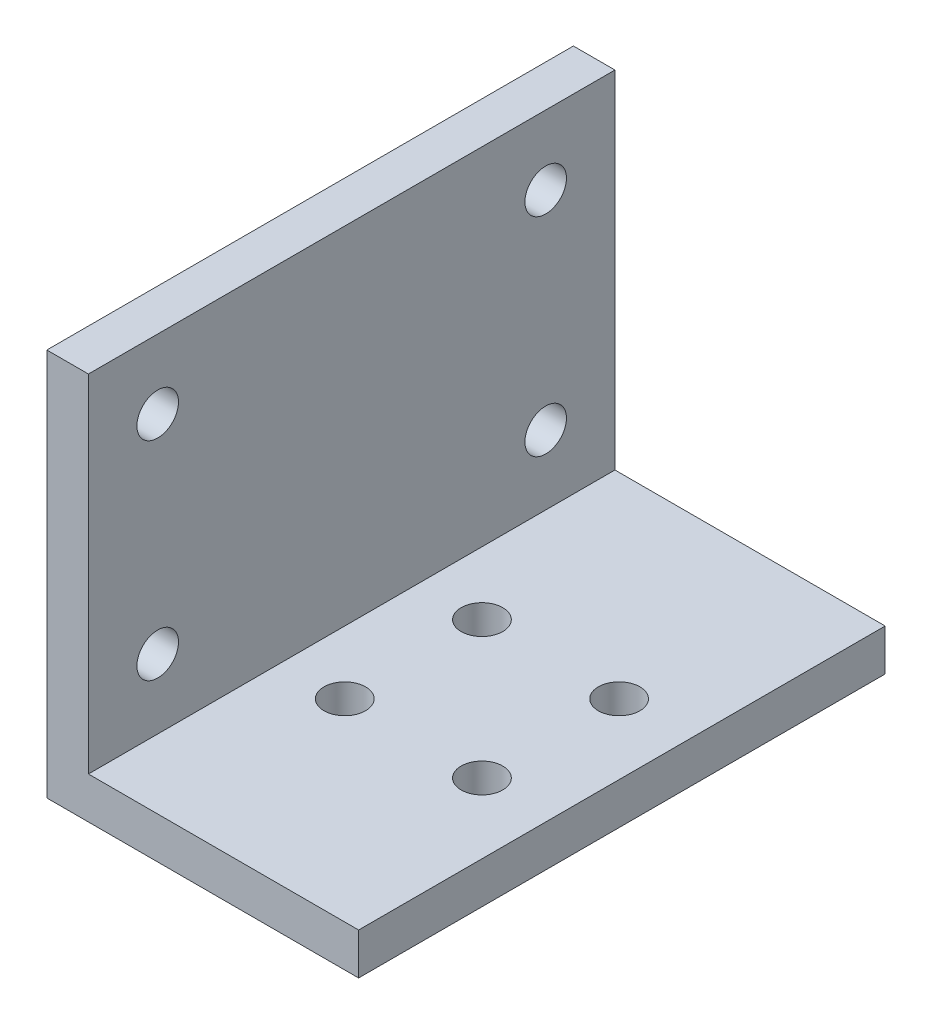
from build123d import *

# Parameters (mm, degrees)
SKETCH_1_W          = 22.5
SKETCH_1_H          = 38
EXTRUDE_1_DEPTH     = 3
SKETCH_2_W          = 3
SKETCH_2_H          = 38
EXTRUDE_2_DEPTH     = 25
SKETCH_3_R          = 1.5
CUT_EXTRUDE_2_DEPTH = 25
SKETCH_4_R          = 1.5
CUT_EXTRUDE_3_DEPTH = 25


with BuildPart() as part:
    # 草图1 → 凸台-拉伸1 (new body)
    with BuildSketch(Plane(origin=(0, 0, 0), x_dir=(1, 0, 0), z_dir=(0, 1, 0))):
        Rectangle(SKETCH_1_W, SKETCH_1_H)
    extrude(amount=EXTRUDE_1_DEPTH)

    # 草图2 → 凸台-拉伸2 (add)
    with BuildSketch(Plane(origin=(0, 3, 0), x_dir=(1, 0, 0), z_dir=(0, 1, 0))):
        with Locations((-9.75, 0)):
            Rectangle(SKETCH_2_W, SKETCH_2_H)
    extrude(amount=EXTRUDE_2_DEPTH)

    # 草图3 → 切除-拉伸2 (cut)
    with BuildSketch(Plane.XZ):
        with Locations((-3.699747468, 5.049747468)):
            Circle(SKETCH_3_R)
        with Locations((6.199747468, 5.049747468)):
            Circle(SKETCH_3_R)
        with Locations((-3.699747468, -4.849747468)):
            Circle(SKETCH_3_R)
        with Locations((6.199747468, -4.849747468)):
            Circle(SKETCH_3_R)
    extrude(amount=-CUT_EXTRUDE_2_DEPTH, mode=Mode.SUBTRACT)

    # 草图4 → 切除-拉伸3 (cut)
    with BuildSketch(Plane(origin=(-8.25, 0, 0), x_dir=(0, 0, -1), z_dir=(1, 0, 0))):
        with Locations((14, 23)):
            Circle(SKETCH_4_R)
        with Locations((-14, 23)):
            Circle(SKETCH_4_R)
        with Locations((-14, 8)):
            Circle(SKETCH_4_R)
        with Locations((14, 8)):
            Circle(SKETCH_4_R)
    extrude(amount=-CUT_EXTRUDE_3_DEPTH, mode=Mode.SUBTRACT)


solid = part.part
